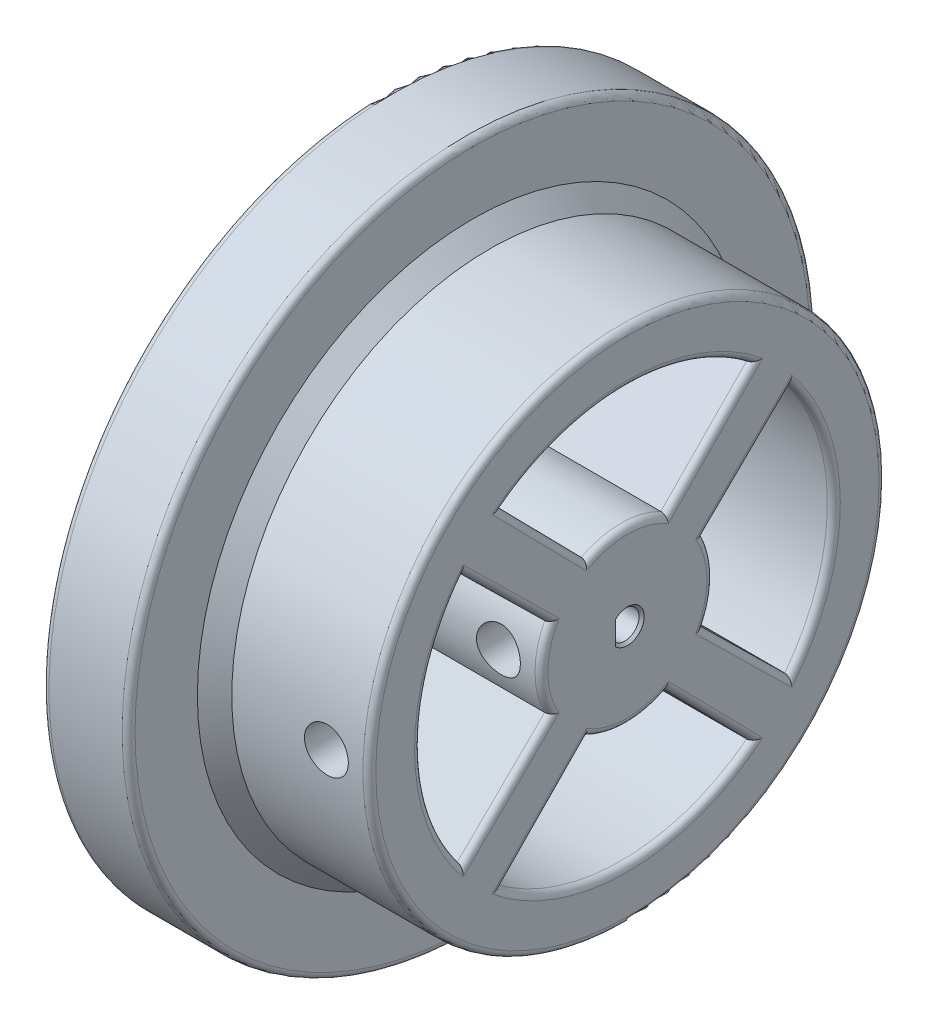
from build123d import *

# Parameters (mm, degrees)
SKETCH1_R           = 40
BOSS_EXTRUDE1_DEPTH = 10
SKETCH2_R           = 30
BOSS_EXTRUDE2_DEPTH = 18
CUT_EXTRUDE1_DEPTH  = 12
CUT_EXTRUDE2_REACH  = 65.119
SKETCH8_R           = 2.5499999999999994
CUT_EXTRUDE3_DEPTH  = 29.7
CHAMFER1_SIZE       = 0.3
CHAMFER2_SIZE       = 2
FILLET1_R           = 0.75
FILLET3_R           = 0.75


with BuildPart() as part:
    # Sketch1 → Boss-Extrude1 (new body)
    with BuildSketch(Plane(origin=(0, 0, 0), x_dir=(0, 0, -1), z_dir=(1, 0, 0))):
        Circle(SKETCH1_R)
    extrude(amount=BOSS_EXTRUDE1_DEPTH)

    # Sketch2 → Boss-Extrude2 (add)
    with BuildSketch(Plane(origin=(10, 0, 0), x_dir=(0, 0, -1), z_dir=(1, 0, 0))):
        Circle(SKETCH2_R)
    extrude(amount=BOSS_EXTRUDE2_DEPTH)

    # Sketch5 → Cut-Extrude1 (cut)
    with BuildSketch(Plane(origin=(27.999999999999996, 0, 0), x_dir=(0, 0, -1), z_dir=(1, 0, 0))):
        with BuildLine():
            Line((-1.0999999999999996, 1.2298373876248847), (-1.0999999999999996, -1.2298373876248847))
            ThreePointArc((-1.0999999999999996, -1.2298373876248847), (1.6500000000000001, 0), (-1.0999999999999996, 1.2298373876248847))
        make_face()
    extrude(amount=-CUT_EXTRUDE1_DEPTH, mode=Mode.SUBTRACT)

    # Sketch6 → Cut-Extrude2 (cut, up to next)
    with BuildSketch(Plane(origin=(27.999999999999996, 0, 0), x_dir=(0, 0, -1), z_dir=(1, 0, 0)), mode=Mode.PRIVATE) as cut_extrude2_sk1:
        with BuildLine():
            ThreePointArc((-4.624048257772944, 8.866689219194898), (1.0166332487e-07, 9.999999999999998), (4.624048438056364, 8.866689125175668))
            Line((4.624048438056364, 8.866689125175668), (14.61202972490862, 19.03913305059836))
            ThreePointArc((14.61202972490862, 19.03913305059836), (1.0206912138e-07, 24), (-14.612029562966324, 19.039133174884796))
            Line((-14.612029562966319, 19.039133174884785), (-4.624048257772941, 8.8666892191949))
        make_face()
    cut_extrude2_tool1 = extrude(cut_extrude2_sk1.sketch, amount=-CUT_EXTRUDE2_REACH, mode=Mode.PRIVATE) & part.part
    # Sketch6 → Cut-Extrude2 (cut, up to next)
    with BuildSketch(Plane(origin=(27.999999999999996, 0, 0), x_dir=(0, 0, -1), z_dir=(1, 0, 0)), mode=Mode.PRIVATE) as cut_extrude2_sk2:
        with BuildLine():
            Line((19.03913305059831, 14.612029724908687), (8.866689125175656, 4.6240484380563975))
            ThreePointArc((8.866689125175656, 4.624048438056398), (10.000000000000002, -1.0166329201e-07), (8.866689031156454, -4.62404861833976))
            Line((8.866689031156454, -4.62404861833976), (19.039132926311993, -14.612029886850854))
            ThreePointArc((19.039132926311993, -14.612029886850854), (24.000000000000004, -1.0206903944e-07), (19.039133050598313, 14.612029724908687))
        make_face()
    cut_extrude2_tool2 = extrude(cut_extrude2_sk2.sketch, amount=-CUT_EXTRUDE2_REACH, mode=Mode.PRIVATE) & part.part
    # Sketch6 → Cut-Extrude2 (cut, up to next)
    with BuildSketch(Plane(origin=(27.999999999999996, 0, 0), x_dir=(0, 0, -1), z_dir=(1, 0, 0)), mode=Mode.PRIVATE) as cut_extrude2_sk3:
        with BuildLine():
            Line((-19.039133050598224, -14.612029724908801), (-8.866689125175627, -4.624048438056444))
            ThreePointArc((-8.866689125175629, -4.624048438056445), (-9.999999999999996, 1.0166329489e-07), (-8.866689031156426, 4.62404861833981))
            Line((-8.866689031156424, 4.624048618339809), (-19.039132926311897, 14.61202988685098))
            ThreePointArc((-19.039132926311893, 14.612029886850976), (-23.999999999999993, 1.0206904388e-07), (-19.039133050598224, -14.612029724908805))
        make_face()
    cut_extrude2_tool3 = extrude(cut_extrude2_sk3.sketch, amount=-CUT_EXTRUDE2_REACH, mode=Mode.PRIVATE) & part.part
    # Sketch6 → Cut-Extrude2 (cut, up to next)
    with BuildSketch(Plane(origin=(27.999999999999996, 0, 0), x_dir=(0, 0, -1), z_dir=(1, 0, 0)), mode=Mode.PRIVATE) as cut_extrude2_sk4:
        with BuildLine():
            ThreePointArc((4.624048257772983, -8.866689219194878), (-1.0166327713e-07, -10.000000000000004), (-4.624048438056319, -8.866689125175693))
            Line((-4.62404843805632, -8.866689125175697), (-14.6120297249085, -19.03913305059845))
            ThreePointArc((-14.6120297249085, -19.03913305059845), (-1.0206897505e-07, -24), (14.612029562966432, -19.039133174884697))
            Line((14.612029562966438, -19.039133174884697), (4.624048257772984, -8.866689219194878))
        make_face()
    cut_extrude2_tool4 = extrude(cut_extrude2_sk4.sketch, amount=-CUT_EXTRUDE2_REACH, mode=Mode.PRIVATE) & part.part
    add(cut_extrude2_tool1.solids().sort_by_distance((28, 17.103807, 0))[0], mode=Mode.SUBTRACT)
    add(cut_extrude2_tool2.solids().sort_by_distance((28, 0, -17.103807))[0], mode=Mode.SUBTRACT)
    add(cut_extrude2_tool3.solids().sort_by_distance((28, 0, 17.103807))[0], mode=Mode.SUBTRACT)
    add(cut_extrude2_tool4.solids().sort_by_distance((28, -17.103807, 0))[0], mode=Mode.SUBTRACT)

    # Sketch8 → Cut-Extrude3 (cut)
    with BuildSketch(Plane.XY.offset(30)):
        with Locations((23, 0)):
            Circle(SKETCH8_R)
    extrude(amount=-CUT_EXTRUDE3_DEPTH, mode=Mode.SUBTRACT)

    # Chamfer1
    chamfer1_edges = [part.edges().sort_by_distance(p)[0] for p in [
        (27.999999999999996, 0, 1.0999999999999996),
        (27.999999999999996, -1.1e-16, -1.6500000000000004),
    ]]
    chamfer(chamfer1_edges, length=CHAMFER1_SIZE)

    # Chamfer2
    chamfer2_edges = [part.edges().sort_by_distance(p)[0] for p in [
        (10, 1.7e-14, 30),
    ]]
    chamfer(chamfer2_edges, length=CHAMFER2_SIZE)

    # Fillet1
    fillet1_edges = [part.edges().sort_by_distance(p)[0] for p in [
        (27.999999999999996, -13.952911197039787, -9.61803891036971),
        (27.999999999999996, -10.000000000000005, 1.0166327757e-07),
        (27.999999999999996, -13.952911087887074, 9.61803908148241),
        (27.999999999999996, -24, 1.0206897771e-07),
        (27.999999999999996, -1.0206904033e-07, -24.000000000000007),
        (27.999999999999996, -9.618039252595306, -13.952910978734224),
        (27.999999999999996, -1.0166329223e-07, -10.000000000000004),
        (27.999999999999996, 9.618039081482543, -13.952911087886982),
        (27.999999999999996, 13.952911087887014, -9.618039081482493),
        (27.999999999999996, 10, -1.0166332531e-07),
        (27.999999999999996, 24.000000000000004, -1.0206912426e-07),
        (27.999999999999996, 13.952911197039843, 9.61803891036963),
        (28, 1.7e-14, 30),
        (27.999999999999996, 9.618039252595395, 13.95291097873416),
        (27.999999999999996, 1.01663296e-07, 9.999999999999996),
        (27.999999999999996, -9.618039081482623, 13.952911087886925),
        (27.999999999999996, 1.0206904388e-07, 23.99999999999999),
    ]]
    fillet(fillet1_edges, radius=FILLET1_R)

    # Fillet3
    fillet3_edges = [part.edges().sort_by_distance(p)[0] for p in [
        (-3.55e-15, -13.952911197039787, -9.61803891036971),
        (0, -24, 1.0206897771e-07),
        (0, -13.952911087887074, 9.618039081482408),
        (0, -10.000000000000005, 1.0166328024e-07),
        (-3.55e-15, -9.618039081482625, 13.952911087886928),
        (0, 1.0206904388e-07, 23.99999999999999),
        (-3.55e-15, 9.618039252595395, 13.95291097873416),
        (0, 1.0166329156e-07, 9.999999999999996),
        (0, 4.9e-15, 40),
        (-3.55e-15, 13.952911197039844, 9.618038910369632),
        (0, 24, -1.0206911893e-07),
        (-3.55e-15, 13.952911087887017, -9.618039081482493),
        (0, 9.999999999999996, -1.0166332709e-07),
        (0, 9.618039081482543, -13.952911087886985),
        (0, -1.0206904033e-07, -24.000000000000007),
        (-3.55e-15, -9.618039252595308, -13.952910978734224),
        (0, -1.0166328956e-07, -10.000000000000004),
        (10, 4.9e-15, 40),
    ]]
    fillet(fillet3_edges, radius=FILLET3_R)


solid = part.part
